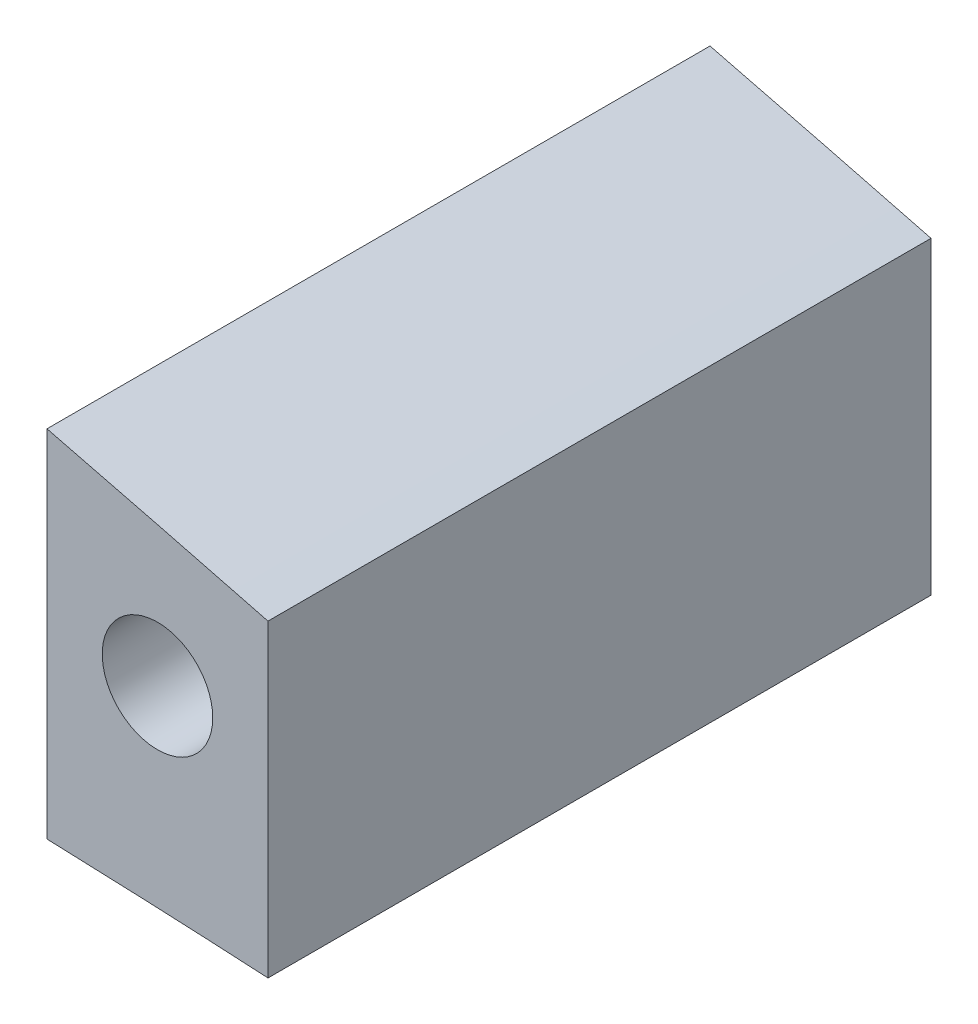
from build123d import *

# Parameters (mm, degrees)
BOSS_EXTRUDE1_DEPTH = 38.1
SKETCH2_R           = 6.35
SKETCH2_R_2         = 3.175
CUT_EXTRUDE1_DEPTH  = 319.018514003
SKETCH3_W           = 116.84
SKETCH3_H           = 50.8
CUT_EXTRUDE2_DEPTH  = 319.018514003
SKETCH4_W           = 250.150530068
SKETCH4_H           = 117.489254048
CUT_EXTRUDE3_DEPTH  = 242.598886965


with BuildPart() as part:
    # Sketch1 → Boss-Extrude1 (new body)
    with BuildSketch(Plane.XY):
        with BuildLine():
            add(Edge.make_bspline(
                [(0.000560351, 0.000130087), (0.810633127, 7.359196055), (8.649092025, 17.856605174), (26.286719818, 29.975176328), (52.111128271, 42.069215275), (89.597618475, 49.290763054), (131.400792109, 47.884831915), (173.256699242, 40.041104278), (217.961060472, 29.612974894), (256.952064401, 19.528920948), (290.35983767, 8.71099439), (301.273197721, 4.382828139), (314.816918223, -0.516206742), (309.846313895, 0.000130087)],
                knots=[0, 0, 0, 0, 0.060863618, 0.113688265, 0.188608742, 0.312908923, 0.448482434, 0.557612135, 0.691544113, 0.852438279, 0.92975597, 0.976058229, 1, 1, 1, 1], degree=3))
            add(Edge.make_bspline(
                [(309.846313895, 0.000130087), (303.956832565, 1.47095521), (293.989507544, 2.093987313), (276.26402299, 4.514356704), (260.846344817, 5.427413394), (235.858814759, 7.870306192), (205.101424636, 8.838080282), (157.718638092, 9.030650149), (110.497331172, 6.181495223), (66.506197185, -0.586669107), (36.454672816, -6.098499901), (15.316603331, -6.189065841), (1.230714189, -6.924076091), (0.000560351, 0.000130087)],
                knots=[0, 0, 0, 0, 0.057787081, 0.095274891, 0.171021118, 0.205339302, 0.335319146, 0.464904334, 0.658702312, 0.785511947, 0.893517288, 0.94309214, 1, 1, 1, 1], degree=3))
        make_face()
    extrude(amount=BOSS_EXTRUDE1_DEPTH)

    # Sketch2 → Cut-Extrude1 (cut, through all)
    with BuildSketch(Plane.XY.offset(38.1)):
        with Locations((20.32, 10.16)):
            Circle(SKETCH2_R)
        with Locations((227.296313895, 19.050130087)):
            Circle(SKETCH2_R_2)
    extrude(amount=-CUT_EXTRUDE1_DEPTH, mode=Mode.SUBTRACT)

    # Sketch3 → Cut-Extrude2 (cut, through all)
    with BuildSketch(Plane.XY.offset(38.1)):
        with Locations((292.066313895, 19.050130087)):
            Rectangle(SKETCH3_W, SKETCH3_H)
    extrude(amount=-CUT_EXTRUDE2_DEPTH, mode=Mode.SUBTRACT)

    # Sketch4 → Cut-Extrude3 (cut, through all)
    with BuildSketch(Plane.XY.offset(38.1)):
        with Locations((95.871048861, 34.528076629)):
            Rectangle(SKETCH4_W, SKETCH4_H)
    extrude(amount=-CUT_EXTRUDE3_DEPTH, mode=Mode.SUBTRACT)


solid = part.part
